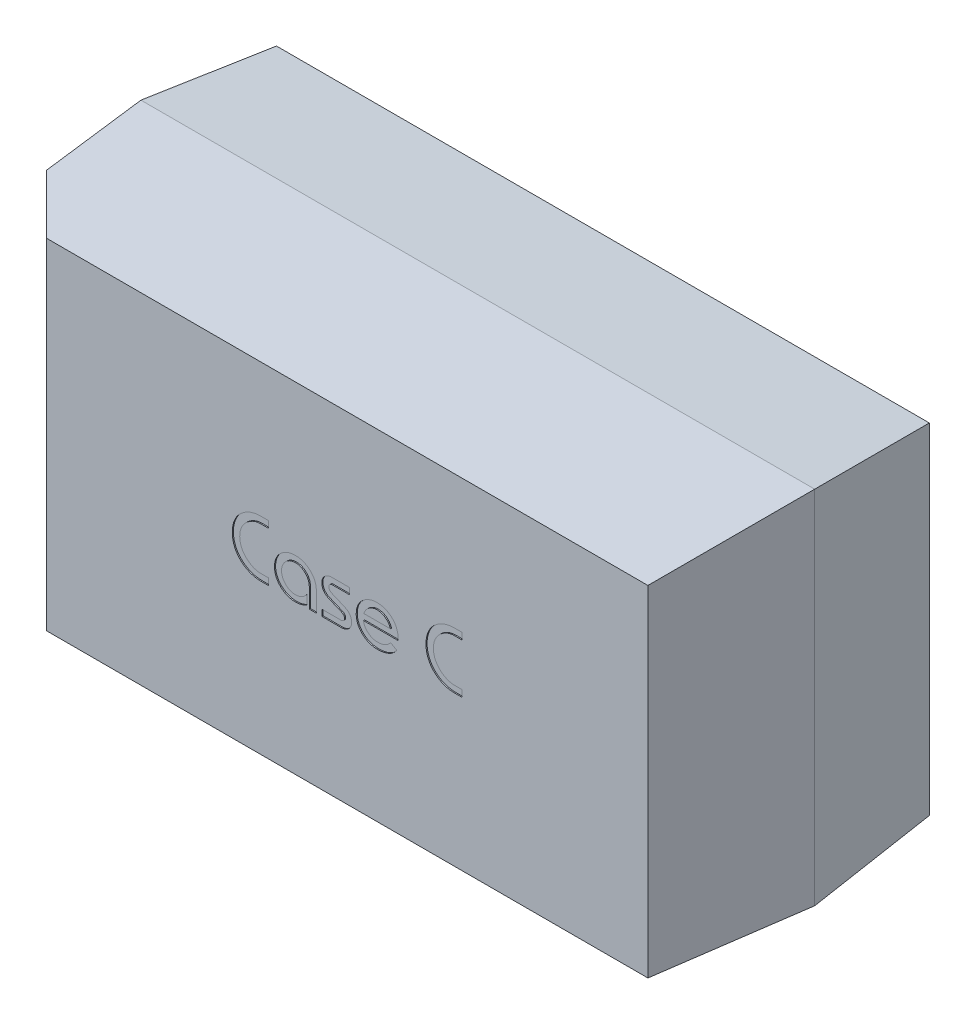
from build123d import *
from OCP.BRepFilletAPI import BRepFilletAPI_MakeChamfer

# Parameters (mm, degrees)
SKETCH1_W           = 6
SKETCH1_H           = 3.22
BOSS_EXTRUDE1_DEPTH = 2.5
CHAMFER3_SIZE       = 1.5
CHAMFER3_SIZE2      = 0.1
CHAMFER4_SIZE       = 0.1
CHAMFER4_SIZE_2     = 1.2
SKETCH2_W           = 3
SKETCH2_H           = 2.82
BOSS_EXTRUDE2_DEPTH = 0.1
CHAMFER5_SIZE       = 0.1
CHAMFER5_SIZE_2     = 0.057735027
CUT_EXTRUDE2_DEPTH  = 0.01
CUT_EXTRUDE4_DEPTH  = 10


# Some blends are built 0.0001 mm under size
with BuildPart() as part:
    # Sketch1 → Boss-Extrude1 (new body)
    with BuildSketch(Plane.XY):
        with Locations((3, 1.61)):
            Rectangle(SKETCH1_W, SKETCH1_H)
    extrude(amount=BOSS_EXTRUDE1_DEPTH)

    # Chamfer3: one chamfer whose edges measure the first distance from different faces: ONE call of the kernel's chamfer builder (chamfer() names one face for all edges)
    chamfer3_edges_1 = [part.edges().sort_by_distance(p)[0] for p in [
        (6, 1.61, 2.5),
    ]]
    chamfer3_side_1 = [part.faces().sort_by_distance(p)[0] for p in [
        (6, 1.61, 1.25),
    ]]
    chamfer3_edges_2 = [part.edges().sort_by_distance(p)[0] for p in [
        (3, 3.22, 2.5),
    ]]
    chamfer3_side_2 = [part.faces().sort_by_distance(p)[0] for p in [
        (3, 3.22, 1.25),
    ]]
    chamfer3_edges_3 = [part.edges().sort_by_distance(p)[0] for p in [
        (0, 1.61, 2.5),
    ]]
    chamfer3_side_3 = [part.faces().sort_by_distance(p)[0] for p in [
        (0, 1.61, 1.25),
    ]]
    chamfer3_edges_4 = [part.edges().sort_by_distance(p)[0] for p in [
        (3, 0, 2.5),
    ]]
    chamfer3_side_4 = [part.faces().sort_by_distance(p)[0] for p in [
        (3, 0, 1.25),
    ]]
    chamfer3 = BRepFilletAPI_MakeChamfer(part.part.solid().wrapped)
    for e in chamfer3_edges_1:
        chamfer3.Add(CHAMFER3_SIZE, CHAMFER3_SIZE2, e.wrapped, chamfer3_side_1[0].wrapped)  # the first distance lies on this face
    for e in chamfer3_edges_2:
        chamfer3.Add(CHAMFER3_SIZE, CHAMFER3_SIZE2, e.wrapped, chamfer3_side_2[0].wrapped)  # the first distance lies on this face
    for e in chamfer3_edges_3:
        chamfer3.Add(CHAMFER3_SIZE, CHAMFER3_SIZE2, e.wrapped, chamfer3_side_3[0].wrapped)  # the first distance lies on this face
    for e in chamfer3_edges_4:
        chamfer3.Add(CHAMFER3_SIZE, CHAMFER3_SIZE2, e.wrapped, chamfer3_side_4[0].wrapped)  # the first distance lies on this face
    add(Compound.cast(chamfer3.Shape()), mode=Mode.REPLACE)

    # Chamfer4
    # the kernel refuses this chamfer: 1.2, 0.1 mm, written as the material it takes off along each edge
    with BuildSketch(Plane(origin=(9.119601408, 3.22, 0), x_dir=(0, -0.9084886210333745, -0.4179095900465526), z_dir=(-1, 0, 0))) as chamfer4_piece_1:
        Polygon((CHAMFER4_SIZE * 0.908488621033, CHAMFER4_SIZE * 0.417909590047), (-CHAMFER4_SIZE_2 * 0.417909590047, CHAMFER4_SIZE_2 * 0.908488621033), (0, 0), align=None)
    extrude(amount=12.239202816, mode=Mode.SUBTRACT)
    with BuildSketch(Plane(origin=(0, 6.339601408, 0), x_dir=(-0.0031944650224573616, 0, 0.9999948976835934), z_dir=(0, -1, 0))) as chamfer4_piece_2:
        Polygon((CHAMFER4_SIZE_2 * 0.999994897684, -CHAMFER4_SIZE_2 * 0.00319446502246), (-CHAMFER4_SIZE * 0.00319446502246, -CHAMFER4_SIZE * 0.999994897684), (0, 0), align=None)
    extrude(amount=9.459202816, mode=Mode.SUBTRACT)
    with BuildSketch(Plane(origin=(-3.119601408, 0, 0), x_dir=(0, -0.0031944650224573663, 0.9999948976835934), z_dir=(1, 0, 0))) as chamfer4_piece_3:
        Polygon((CHAMFER4_SIZE_2 * 0.999994897684, -CHAMFER4_SIZE_2 * 0.00319446502246), (-CHAMFER4_SIZE * 0.00319446502246, -CHAMFER4_SIZE * 0.999994897684), (0, 0), align=None)
    extrude(amount=12.239202816, mode=Mode.SUBTRACT)
    with BuildSketch(Plane(origin=(6, -3.119601408, 0), x_dir=(-0.9084886210333732, 0, -0.41790959004655553), z_dir=(0, 1, 0))) as chamfer4_piece_4:
        Polygon((CHAMFER4_SIZE * 0.908488621033, CHAMFER4_SIZE * 0.417909590047), (-CHAMFER4_SIZE_2 * 0.417909590047, CHAMFER4_SIZE_2 * 0.908488621033), (0, 0), align=None)
    extrude(amount=9.459202816, mode=Mode.SUBTRACT)

    # Sketch2 → Boss-Extrude2 (add)
    with BuildSketch(Plane(origin=(0, 0, 0), x_dir=(-1, 0, 0), z_dir=(0, 0, -1))):
        with Locations((-3, 1.61)):
            Rectangle(SKETCH2_W, SKETCH2_H)
    extrude(amount=BOSS_EXTRUDE2_DEPTH)

    # Chamfer5
    chamfer5_edges_1 = [part.edges().sort_by_distance(p)[0] for p in [
        (4.5, 1.61, -0.1),
    ]]
    chamfer5_side_1 = [part.faces().sort_by_distance(p)[0] for p in [
        (4.5, 1.61, -0.098845299),
    ]]
    chamfer5_edges_2 = [part.edges().sort_by_distance(p)[0] for p in [
        (1.5, 1.61, -0.1),
    ]]
    chamfer5_side_2 = [part.faces().sort_by_distance(p)[0] for p in [
        (1.5, 1.61, -0.098845299),
    ]]
    chamfer5 = BRepFilletAPI_MakeChamfer(part.part.solid().wrapped)
    for e in chamfer5_edges_1:
        chamfer5.Add(CHAMFER5_SIZE - 0.0001, CHAMFER5_SIZE_2 - 0.0001, e.wrapped, chamfer5_side_1[0].wrapped)
    for e in chamfer5_edges_2:
        chamfer5.Add(CHAMFER5_SIZE - 0.0001, CHAMFER5_SIZE_2 - 0.0001, e.wrapped, chamfer5_side_2[0].wrapped)
    add(Compound.cast(chamfer5.Shape()), mode=Mode.REPLACE)  # a hair under: the kernel refuses the full size

    # Sketch5 → Cut-Extrude2 (cut)
    # profile 1 of 5: a face of its own
    with BuildSketch(Plane.XY.offset(2.5)):
        with BuildLine():
            Line((2.529784113, 1.433715838), (2.458954752, 1.433715838))
            add(Edge.make_bspline(
                [(2.458954752, 1.433715838), (2.451190353, 1.433915465), (2.435661817, 1.434314712), (2.412572822, 1.437611037), (2.389708123, 1.44272445), (2.367362746, 1.450072166), (2.345777626, 1.459250485), (2.325338048, 1.470309808), (2.306096157, 1.483008978), (2.294359969, 1.492862526), (2.288506706, 1.497776848)],
                knots=[0, 0, 0, 0, 1.001208266, 2.002382965, 3.002776937, 4.02036543, 5.032265952, 6.024514095, 7.01475349, 8, 8, 8, 8], degree=3))
            add(Edge.make_bspline(
                [(2.288506706, 1.497776848), (2.285293577, 1.500662797), (2.278886431, 1.506417527), (2.269958918, 1.515670333), (2.261623531, 1.525372657), (2.253832558, 1.535409356), (2.246643469, 1.545902391), (2.239962406, 1.556716952), (2.233934527, 1.568030385), (2.228560439, 1.579736064), (2.223596284, 1.591739177), (2.219640099, 1.604166088), (2.21586327, 1.616760339), (2.213133303, 1.629725782), (2.210727446, 1.642900515), (2.209340551, 1.656384857), (2.208146695, 1.67011053), (2.208081844, 1.679375501), (2.208049127, 1.684049489)],
                knots=[0, 0, 0, 0, 0.989761973, 1.973636693, 2.944619594, 3.920779654, 4.884522862, 5.858942109, 6.833279679, 7.820733948, 8.810844291, 9.808215719, 10.808747302, 11.823181674, 12.843456966, 13.877087317, 14.929034146, 16, 16, 16, 16], degree=3))
            add(Edge.make_bspline(
                [(2.208049127, 1.684049489), (2.208085561, 1.6886912), (2.208157777, 1.697891713), (2.209300205, 1.711564812), (2.210893816, 1.724955471), (2.213046514, 1.738118175), (2.216057646, 1.750948017), (2.21954722, 1.763567868), (2.223761216, 1.775880538), (2.22861429, 1.787918588), (2.234177141, 1.799583643), (2.240119345, 1.810985492), (2.246850349, 1.821859433), (2.254110065, 1.832329929), (2.261824395, 1.842514232), (2.27025244, 1.852202176), (2.27916484, 1.861589787), (2.285577386, 1.867405886), (2.288792693, 1.87032213)],
                knots=[0, 0, 0, 0, 1.063584854, 2.108172223, 3.142553315, 4.154327922, 5.163162232, 6.16161076, 7.154304801, 8.1443234, 9.134770556, 10.115448767, 11.089777724, 12.063562089, 13.035192332, 14.016357246, 15.005384098, 16, 16, 16, 16], degree=3))
            add(Edge.make_bspline(
                [(2.288792693, 1.87032213), (2.29466852, 1.875220196), (2.306426316, 1.885021449), (2.325880333, 1.89738303), (2.346325602, 1.908360532), (2.367910155, 1.917452404), (2.390243052, 1.924664553), (2.412934442, 1.929952197), (2.435892586, 1.933085503), (2.451255528, 1.933505403), (2.458954752, 1.933715838)],
                knots=[0, 0, 0, 0, 0.9893158, 1.9796658, 2.977055556, 3.990876023, 5.006830535, 6.011631783, 7.00351827, 8, 8, 8, 8], degree=3))
            Line((2.458954752, 1.933715838), (2.528830824, 1.933715838))
            Line((2.528830824, 1.933715838), (2.529784113, 1.8745166))
            Line((2.529784113, 1.8745166), (2.458954752, 1.8745166))
            add(Edge.make_bspline(
                [(2.458954752, 1.8745166), (2.453735363, 1.874335104), (2.443145163, 1.873966846), (2.427179909, 1.871442371), (2.41107759, 1.867023486), (2.394909158, 1.861203091), (2.379087308, 1.853766531), (2.363898006, 1.845088791), (2.349446053, 1.835139633), (2.340555703, 1.827537201), (2.336075819, 1.823706305)],
                knots=[0, 0, 0, 0, 0.922399681, 1.871559692, 2.848297118, 3.869795982, 4.904912568, 5.933748764, 6.958807485, 8, 8, 8, 8], degree=3))
            add(Edge.make_bspline(
                [(2.336075819, 1.823706305), (2.331105192, 1.818979442), (2.321336195, 1.809689529), (2.308742444, 1.794168664), (2.297944434, 1.777932532), (2.289264442, 1.760753876), (2.282400243, 1.742777598), (2.277601653, 1.723937371), (2.274510935, 1.70426578), (2.274183244, 1.690861416), (2.274016716, 1.684049489)],
                knots=[0, 0, 0, 0, 1.043561491, 2.05095784, 3.036015611, 4.007647816, 4.975513617, 5.960167242, 6.963383094, 8, 8, 8, 8], degree=3))
            add(Edge.make_bspline(
                [(2.274016716, 1.684049489), (2.274183545, 1.677237673), (2.274511828, 1.663833526), (2.277598239, 1.644160353), (2.282420076, 1.625297121), (2.289241336, 1.60727309), (2.297943772, 1.590069467), (2.308768889, 1.573824644), (2.32132967, 1.558218298), (2.33110371, 1.548864842), (2.336075819, 1.544106686)],
                knots=[0, 0, 0, 0, 1.035104675, 2.036857023, 3.020074222, 3.991046645, 4.961261421, 5.944882176, 6.954549968, 8, 8, 8, 8], degree=3))
            add(Edge.make_bspline(
                [(2.336075819, 1.544106686), (2.340550587, 1.54020653), (2.349414296, 1.532481023), (2.36390127, 1.522450463), (2.379059726, 1.51364666), (2.394915419, 1.506246703), (2.411058372, 1.500365078), (2.427206728, 1.496148117), (2.44313335, 1.49342721), (2.453733108, 1.493084098), (2.458954752, 1.492915075)],
                knots=[0, 0, 0, 0, 1.04672343, 2.073370516, 3.10338066, 4.136864607, 5.156752309, 6.130513482, 7.079055176, 8, 8, 8, 8], degree=3))
            Line((2.458954752, 1.492915075), (2.528830824, 1.492915075))
            Line((2.528830824, 1.492915075), (2.529784113, 1.433715838))
        make_face()
    # profile 2 of 5: a face of its own
    with BuildSketch(Plane.XY.offset(2.5)):
        with BuildLine():
            add(Edge.make_bspline(
                [(2.768773627, 1.729521367), (2.764603807, 1.729419163), (2.756386844, 1.729217763), (2.744305804, 1.727388142), (2.732630394, 1.724740922), (2.721511362, 1.72059814), (2.710736846, 1.715609505), (2.700548212, 1.709191665), (2.69066634, 1.701899867), (2.681531066, 1.693406445), (2.673079655, 1.684276449), (2.665701265, 1.674506643), (2.659447032, 1.664264632), (2.654428972, 1.653528209), (2.650295901, 1.642403039), (2.647646038, 1.6307293), (2.64581713, 1.618647808), (2.645615632, 1.610430908), (2.645513379, 1.606261119)],
                knots=[0, 0, 0, 0, 1.032177917, 2.033988752, 3.021003279, 3.992039754, 4.967309703, 5.956831733, 6.969039607, 8.00520122, 9.041362833, 10.047277634, 11.032690297, 12.007960246, 12.978996721, 13.966011248, 14.967822083, 16, 16, 16, 16], degree=3))
            add(Edge.make_bspline(
                [(2.645513379, 1.606261119), (2.645616789, 1.602091658), (2.645820565, 1.593875403), (2.647628257, 1.58181983), (2.650335831, 1.570163808), (2.654381146, 1.559038117), (2.659473754, 1.548332315), (2.6657269, 1.538099761), (2.673047274, 1.528253046), (2.681534021, 1.519117029), (2.690669759, 1.51062889), (2.700518911, 1.503314184), (2.710766831, 1.497025445), (2.721507408, 1.492012962), (2.73263147, 1.487878404), (2.74430551, 1.485228945), (2.756386921, 1.483399929), (2.764603832, 1.483198446), (2.768773627, 1.4830962)],
                knots=[0, 0, 0, 0, 1.032511964, 2.03464702, 3.01432259, 3.993080195, 4.961554741, 5.947286317, 6.959821775, 7.996318725, 9.032815675, 10.045351133, 11.031082708, 12.006668287, 12.978019023, 13.96535298, 14.967488036, 16, 16, 16, 16], degree=3))
            add(Edge.make_bspline(
                [(2.768773627, 1.4830962), (2.77390256, 1.483281816), (2.784076562, 1.483650012), (2.799059849, 1.486532908), (2.813589113, 1.491099201), (2.827448584, 1.497620575), (2.840543926, 1.505696049), (2.85245768, 1.515364096), (2.863256468, 1.526425777), (2.869259036, 1.534807086), (2.872300796, 1.539054255)],
                knots=[0, 0, 0, 0, 1.003913901, 1.991412451, 2.977497989, 3.979848145, 4.983241069, 5.983386257, 6.978094989, 8, 8, 8, 8], degree=3))
            Line((2.872300796, 1.539054255), (2.872300796, 1.456022797))
            add(Edge.make_bspline(
                [(2.872300796, 1.456022797), (2.868326319, 1.453712614), (2.860418623, 1.449116228), (2.848091962, 1.443212296), (2.835506436, 1.438247807), (2.822658777, 1.434235129), (2.809569075, 1.43108682), (2.796199799, 1.428778238), (2.782560275, 1.427437138), (2.773384032, 1.427238132), (2.768773627, 1.427138145)],
                knots=[0, 0, 0, 0, 1.013340786, 2.016162684, 3.010207893, 3.994126741, 4.981482304, 5.976712076, 6.983442674, 8, 8, 8, 8], degree=3))
            add(Edge.make_bspline(
                [(2.768773627, 1.427138145), (2.762568702, 1.427305833), (2.750268099, 1.427638256), (2.732049788, 1.430217413), (2.714298712, 1.434281374), (2.697088924, 1.440019706), (2.680637496, 1.447319566), (2.665106905, 1.456199055), (2.650409043, 1.466317372), (2.641556649, 1.474258478), (2.637124437, 1.478234427)],
                knots=[0, 0, 0, 0, 1.029305989, 2.040489696, 3.047112572, 4.047571049, 5.04605445, 6.028396224, 7.012858436, 8, 8, 8, 8], degree=3))
            add(Edge.make_bspline(
                [(2.637124437, 1.478234427), (2.632765227, 1.482559678), (2.624192071, 1.491066048), (2.613203161, 1.505279026), (2.603783787, 1.520159825), (2.596154735, 1.535914316), (2.590050726, 1.55236234), (2.585943045, 1.569654792), (2.583244237, 1.587682395), (2.582941292, 1.599991093), (2.582786973, 1.606261119)],
                knots=[0, 0, 0, 0, 1.028335175, 2.022402705, 3.00363116, 3.975505791, 4.951123991, 5.938060159, 6.949652064, 8, 8, 8, 8], degree=3))
            add(Edge.make_bspline(
                [(2.582786973, 1.606261119), (2.582943556, 1.612530776), (2.583251731, 1.624870221), (2.585928686, 1.642933821), (2.590070755, 1.660279888), (2.596132147, 1.676774716), (2.603783053, 1.692554678), (2.613229376, 1.7074454), (2.624185754, 1.721742406), (2.632763792, 1.730312513), (2.637124437, 1.734669127)],
                knots=[0, 0, 0, 0, 1.047948555, 2.062489918, 3.047171561, 4.025552603, 4.995207116, 5.974194084, 6.970181577, 8, 8, 8, 8], degree=3))
            add(Edge.make_bspline(
                [(2.637124437, 1.734669127), (2.641555788, 1.738615912), (2.650408292, 1.746500401), (2.665138398, 1.756497166), (2.680610693, 1.765418172), (2.6971125, 1.772582733), (2.71431079, 1.77830479), (2.732027288, 1.782557721), (2.750278385, 1.784939236), (2.762570734, 1.785298256), (2.768773627, 1.785479422)],
                knots=[0, 0, 0, 0, 0.984707269, 1.967148561, 2.950482705, 3.947840172, 4.949309321, 5.958151076, 6.969654197, 8, 8, 8, 8], degree=3))
            add(Edge.make_bspline(
                [(2.768773627, 1.785479422), (2.774976514, 1.785298248), (2.787268852, 1.784939213), (2.805520028, 1.782557811), (2.823236232, 1.778304456), (2.840435609, 1.772583964), (2.856933403, 1.765413623), (2.872397799, 1.756526892), (2.887053097, 1.746468509), (2.895892783, 1.738611061), (2.900327488, 1.734669127)],
                knots=[0, 0, 0, 0, 1.030904303, 2.04295571, 3.05234431, 4.054356306, 5.052254392, 6.036121553, 7.014758969, 8, 8, 8, 8], degree=3))
            add(Edge.make_bspline(
                [(2.900327488, 1.734669127), (2.904687242, 1.730312101), (2.913263527, 1.721741183), (2.924232651, 1.707450071), (2.933639294, 1.692525689), (2.94146433, 1.676822488), (2.947345441, 1.660254559), (2.951533808, 1.642937914), (2.954197416, 1.624869145), (2.954507433, 1.612530413), (2.954664952, 1.606261119)],
                knots=[0, 0, 0, 0, 1.029749437, 2.025670211, 3.004591598, 3.976522513, 4.953032564, 5.937648245, 6.952121645, 8, 8, 8, 8], degree=3))
            Line((2.954664952, 1.606261119), (2.954664952, 1.43352518))
            Line((2.954664952, 1.43352518), (2.891938546, 1.43352518))
            Line((2.891938546, 1.43352518), (2.891938546, 1.606261119))
            add(Edge.make_bspline(
                [(2.891938546, 1.606261119), (2.891836335, 1.610430933), (2.891634919, 1.618647885), (2.889805407, 1.630729007), (2.887157784, 1.642404115), (2.883016484, 1.653524255), (2.878022283, 1.664294611), (2.871639219, 1.674477554), (2.864283378, 1.684279697), (2.855827063, 1.693410071), (2.846696412, 1.701865002), (2.836896684, 1.709226462), (2.826728993, 1.715573723), (2.815993525, 1.720648263), (2.804871773, 1.724700351), (2.793214688, 1.727406096), (2.781159403, 1.729214283), (2.772943108, 1.729417992), (2.768773627, 1.729521367)],
                knots=[0, 0, 0, 0, 1.03279397, 2.035202735, 3.022806359, 3.994422395, 4.970274432, 5.960387057, 6.966902236, 8.003682281, 9.040462325, 10.046977504, 11.037090129, 12.005829191, 12.98485412, 13.964797265, 14.96720603, 16, 16, 16, 16], degree=3))
        make_face()
    # profile 3 of 5: a face of its own
    with BuildSketch(Plane.XY.offset(2.5)):
        with BuildLine():
            Line((3.176495267, 1.555450824), (3.064579156, 1.60273395))
            add(Edge.make_bspline(
                [(3.064579156, 1.60273395), (3.059713235, 1.604956968), (3.050296801, 1.609258909), (3.037649109, 1.617653061), (3.026937059, 1.627354625), (3.018138527, 1.638310273), (3.011371884, 1.650581514), (3.006468073, 1.664071695), (3.003606947, 1.678877179), (3.003266964, 1.689152932), (3.003092025, 1.694440337)],
                knots=[0, 0, 0, 0, 1.086913206, 2.103373124, 3.073395331, 4.016225338, 4.947889024, 5.91097369, 6.92508807, 8, 8, 8, 8], degree=3))
            add(Edge.make_bspline(
                [(3.003092025, 1.694440337), (3.003152698, 1.697305449), (3.003271947, 1.702936705), (3.004591011, 1.71120063), (3.006562361, 1.71916969), (3.009424545, 1.726823868), (3.013202768, 1.734106552), (3.017711677, 1.741088485), (3.022951256, 1.747814436), (3.029068337, 1.754020125), (3.035665017, 1.759843066), (3.042796366, 1.764888831), (3.050316247, 1.769063373), (3.05806637, 1.772715344), (3.066303533, 1.775278393), (3.074818836, 1.777364944), (3.083741779, 1.778491794), (3.089806739, 1.778637138), (3.092891835, 1.778711071)],
                knots=[0, 0, 0, 0, 1.002829457, 1.971019315, 2.92405256, 3.875133533, 4.826019057, 5.792479604, 6.783438632, 7.806815997, 8.840374075, 9.86266113, 10.859541967, 11.850813551, 12.857589228, 13.875503362, 14.919320925, 16, 16, 16, 16], degree=3))
            Line((3.092891835, 1.778711071), (3.250470481, 1.778711071))
            Line((3.250470481, 1.778711071), (3.250470481, 1.722753016))
            Line((3.250470481, 1.722753016), (3.09670499, 1.722753016))
            add(Edge.make_bspline(
                [(3.09670499, 1.722753016), (3.094629324, 1.722674414), (3.090576545, 1.722520943), (3.084745902, 1.720933485), (3.079397444, 1.718321358), (3.074721887, 1.714714003), (3.070718831, 1.710461275), (3.067971537, 1.705494634), (3.066114203, 1.700130226), (3.065918364, 1.696362777), (3.065818431, 1.694440337)],
                knots=[0, 0, 0, 0, 1.066372243, 2.082113002, 3.084329393, 4.111595171, 5.107383598, 6.067048916, 7.013660775, 8, 8, 8, 8], degree=3))
            add(Edge.make_bspline(
                [(3.065818431, 1.694440337), (3.065875859, 1.692051244), (3.065985473, 1.687491177), (3.067231462, 1.681060732), (3.069259666, 1.675402496), (3.072051381, 1.670342752), (3.076063859, 1.665952404), (3.081114621, 1.661988743), (3.087151163, 1.658116938), (3.09171785, 1.655998393), (3.09413111, 1.65487885)],
                knots=[0, 0, 0, 0, 1.09441688, 2.088916165, 2.987755487, 3.842645348, 4.719966779, 5.693972068, 6.781382117, 8, 8, 8, 8], degree=3))
            Line((3.09413111, 1.65487885), (3.202901368, 1.608834999))
            add(Edge.make_bspline(
                [(3.202901368, 1.608834999), (3.208053251, 1.606484631), (3.217997915, 1.601947723), (3.231357072, 1.593267987), (3.242785079, 1.583540006), (3.252036106, 1.572523938), (3.259353829, 1.560466443), (3.264394804, 1.547186648), (3.267527209, 1.532844336), (3.267910031, 1.522896657), (3.268106325, 1.517795914)],
                knots=[0, 0, 0, 0, 1.135523047, 2.191896784, 3.186910699, 4.13766825, 5.067609298, 6.00469982, 6.976895781, 8, 8, 8, 8], degree=3))
            add(Edge.make_bspline(
                [(3.268106325, 1.517795914), (3.268055448, 1.514897454), (3.267955354, 1.509194996), (3.266492678, 1.500846992), (3.264496988, 1.492775526), (3.261327396, 1.485132859), (3.257576501, 1.477701781), (3.252694583, 1.470771918), (3.247188545, 1.464004868), (3.240712882, 1.457834202), (3.233713406, 1.452089269), (3.226168994, 1.447173473), (3.218286606, 1.442900409), (3.209943707, 1.43946738), (3.201161018, 1.436806279), (3.191972333, 1.434910073), (3.182404424, 1.433734885), (3.175894924, 1.433595842), (3.172586782, 1.43352518)],
                knots=[0, 0, 0, 0, 0.978646858, 1.92539877, 2.858333228, 3.784063451, 4.716317137, 5.666962661, 6.643661373, 7.661792299, 8.685350883, 9.701495763, 10.701321719, 11.712912426, 12.746124259, 13.799692543, 14.881799231, 16, 16, 16, 16], degree=3))
            Line((3.172586782, 1.43352518), (3.003759328, 1.43352518))
            Line((3.003759328, 1.43352518), (3.003759328, 1.489483235))
            Line((3.003759328, 1.489483235), (3.16848764, 1.489483235))
            add(Edge.make_bspline(
                [(3.16848764, 1.489483235), (3.170977813, 1.489548677), (3.175824972, 1.489676061), (3.182709665, 1.491412892), (3.18911399, 1.493866137), (3.1946965, 1.497455468), (3.199452011, 1.501722715), (3.202958951, 1.506612161), (3.205111538, 1.512068664), (3.205352976, 1.515870531), (3.205475247, 1.517795914)],
                knots=[0, 0, 0, 0, 1.154928907, 2.248086845, 3.282544077, 4.331984353, 5.315035, 6.23746919, 7.107399511, 8, 8, 8, 8], degree=3))
            add(Edge.make_bspline(
                [(3.205475247, 1.517795914), (3.20537799, 1.519867687), (3.205187362, 1.523928414), (3.203856981, 1.529817879), (3.201493945, 1.535231067), (3.198340536, 1.54027151), (3.194159697, 1.544765197), (3.189102828, 1.548810327), (3.183161, 1.552429865), (3.178775123, 1.554417576), (3.176495267, 1.555450824)],
                knots=[0, 0, 0, 0, 0.979821605, 1.920474361, 2.836181352, 3.761825304, 4.719258691, 5.723895598, 6.816840502, 8, 8, 8, 8], degree=3))
        make_face()
    # profile 4 of 5: a face of its own
    with BuildSketch(Plane.XY.offset(2.5)):
        with BuildLine():
            add(Edge.make_bspline(
                [(3.499183541, 1.4830962), (3.505199856, 1.483246712), (3.51703976, 1.483542913), (3.534328492, 1.48630255), (3.550786179, 1.490655799), (3.566212868, 1.496845721), (3.580432352, 1.504650274), (3.593240941, 1.513902647), (3.604361948, 1.524745792), (3.610384077, 1.533020675), (3.613387545, 1.537147678)],
                knots=[0, 0, 0, 0, 1.096631666, 2.158134203, 3.18443435, 4.196098216, 5.181796095, 6.135856248, 7.070279626, 8, 8, 8, 8], degree=3))
            Line((3.613387545, 1.537147678), (3.668773627, 1.505593817))
            add(Edge.make_bspline(
                [(3.668773627, 1.505593817), (3.666535586, 1.502378553), (3.662092993, 1.495996135), (3.654573266, 1.487123031), (3.646591984, 1.478831094), (3.638053015, 1.471152571), (3.628979405, 1.464121158), (3.619439905, 1.457583253), (3.60931777, 1.451789066), (3.59867094, 1.44662035), (3.587517307, 1.442063793), (3.575839022, 1.438047283), (3.563626424, 1.434600869), (3.550856203, 1.431855788), (3.53754762, 1.429775229), (3.52374149, 1.428275728), (3.509398677, 1.427267665), (3.499661956, 1.42718185), (3.494703084, 1.427138145)],
                knots=[0, 0, 0, 0, 0.942964575, 1.871819471, 2.797263628, 3.713038984, 4.634551539, 5.559964056, 6.495853453, 7.440462311, 8.408221378, 9.395599076, 10.413120145, 11.462291805, 12.53922733, 13.655571982, 14.805992184, 16, 16, 16, 16], degree=3))
            add(Edge.make_bspline(
                [(3.494703084, 1.427138145), (3.488498074, 1.427305644), (3.476197301, 1.427637693), (3.457980241, 1.430219614), (3.440224458, 1.434273177), (3.423044329, 1.440045983), (3.406539525, 1.44719646), (3.39106802, 1.456121177), (3.376337707, 1.466116971), (3.367485231, 1.47400159), (3.363053894, 1.47794844)],
                knots=[0, 0, 0, 0, 1.030410189, 2.042678656, 3.050381398, 4.051913128, 5.04933292, 6.032728512, 7.015231197, 8, 8, 8, 8], degree=3))
            add(Edge.make_bspline(
                [(3.363053894, 1.47794844), (3.358691827, 1.482304178), (3.350110993, 1.490872562), (3.339191306, 1.505160687), (3.329681598, 1.519980529), (3.322089533, 1.535727115), (3.315978738, 1.552170742), (3.311872876, 1.5694644), (3.309178393, 1.587460182), (3.308872077, 1.599736952), (3.30871643, 1.605975132)],
                knots=[0, 0, 0, 0, 1.032406655, 2.030897353, 3.007837836, 3.979929372, 4.95576531, 5.942921743, 6.954739417, 8, 8, 8, 8], degree=3))
            add(Edge.make_bspline(
                [(3.30871643, 1.605975132), (3.308869839, 1.612245405), (3.309170998, 1.624554588), (3.311887317, 1.642609279), (3.315958393, 1.659943964), (3.322111463, 1.676435929), (3.329680928, 1.692251896), (3.339163254, 1.707157408), (3.350114053, 1.721456944), (3.358692858, 1.730026703), (3.363053894, 1.73438314)],
                knots=[0, 0, 0, 0, 1.047989187, 2.057309378, 3.047192212, 4.020619482, 4.995090611, 5.974115537, 6.970141648, 8, 8, 8, 8], degree=3))
            add(Edge.make_bspline(
                [(3.363053894, 1.73438314), (3.367492604, 1.738349373), (3.376371607, 1.746283254), (3.390976593, 1.756545755), (3.40660112, 1.765268885), (3.423010798, 1.77261784), (3.440245369, 1.778294204), (3.457955372, 1.782560559), (3.476208193, 1.78493851), (3.488500309, 1.785298012), (3.494703084, 1.785479422)],
                knots=[0, 0, 0, 0, 0.987025885, 1.974403735, 2.954037546, 3.95240394, 4.952745179, 5.960450721, 6.97081463, 8, 8, 8, 8], degree=3))
            add(Edge.make_bspline(
                [(3.494703084, 1.785479422), (3.500905853, 1.785298005), (3.513197958, 1.784938487), (3.531450859, 1.782560649), (3.549160562, 1.77829387), (3.566396244, 1.77261908), (3.582801813, 1.765264304), (3.598418739, 1.756575177), (3.612948267, 1.746251335), (3.621814792, 1.73834449), (3.626256944, 1.73438314)],
                knots=[0, 0, 0, 0, 1.029739185, 2.040646782, 3.04889458, 4.049774113, 5.048677738, 6.0288387, 7.012442986, 8, 8, 8, 8], degree=3))
            add(Edge.make_bspline(
                [(3.626256944, 1.73438314), (3.63061709, 1.730026293), (3.639194145, 1.721455729), (3.650157669, 1.707162051), (3.659600297, 1.69222304), (3.667343957, 1.676483653), (3.67331643, 1.659918432), (3.677434082, 1.64261338), (3.680137059, 1.624553508), (3.68044006, 1.612245041), (3.680594409, 1.605975132)],
                knots=[0, 0, 0, 0, 1.029792029, 2.025753997, 3.004715874, 3.981454246, 4.953004026, 5.942823112, 6.952078303, 8, 8, 8, 8], degree=3))
            Line((3.680594409, 1.605975132), (3.680594409, 1.586337382))
            Line((3.680594409, 1.586337382), (3.37277744, 1.586337382))
            add(Edge.make_bspline(
                [(3.37277744, 1.586337382), (3.373444868, 1.582700932), (3.374764245, 1.575512358), (3.377833663, 1.565060053), (3.381895398, 1.555103688), (3.386711556, 1.545558617), (3.392527476, 1.536542682), (3.399065841, 1.527941176), (3.406615948, 1.519885628), (3.414899038, 1.512312363), (3.423937191, 1.505514321), (3.43338986, 1.499434656), (3.443332153, 1.494383077), (3.453686987, 1.490290526), (3.464416667, 1.486998287), (3.475621778, 1.484728662), (3.487266377, 1.48338719), (3.495176212, 1.48319405), (3.499183541, 1.4830962)],
                knots=[0, 0, 0, 0, 0.996282716, 1.969462242, 2.930309334, 3.891958069, 4.847290049, 5.818809116, 6.800809464, 7.819635613, 8.840800131, 9.846065981, 10.84602503, 11.841865674, 12.844573127, 13.867747955, 14.919745267, 16, 16, 16, 16], degree=3))
        make_face()
        with BuildLine():
            Line((3.376685924, 1.642295437), (3.612815572, 1.642295437))
            add(Edge.make_bspline(
                [(3.612815572, 1.642295437), (3.611774733, 1.64542328), (3.609708846, 1.651631513), (3.605931234, 1.660646243), (3.60125994, 1.669109407), (3.596209027, 1.677296793), (3.590141677, 1.684794995), (3.58372822, 1.692130718), (3.57643886, 1.698839628), (3.568646278, 1.705126284), (3.560413127, 1.710836066), (3.551796134, 1.715755955), (3.543031996, 1.720132882), (3.533885775, 1.723562958), (3.524473589, 1.72621823), (3.514814747, 1.728120978), (3.504901458, 1.729313422), (3.498201886, 1.729451315), (3.494798412, 1.729521367)],
                knots=[0, 0, 0, 0, 1.006096813, 1.996930292, 2.977696053, 3.954424932, 4.928453262, 5.917576276, 6.926334417, 7.94728217, 8.972322098, 9.980473887, 10.973820191, 11.959179279, 12.957061003, 13.955696628, 14.961466125, 16, 16, 16, 16], degree=3))
            add(Edge.make_bspline(
                [(3.494798412, 1.729521367), (3.491426885, 1.729449703), (3.484759437, 1.729307983), (3.474907118, 1.728130682), (3.465314321, 1.726215406), (3.455962653, 1.723561476), (3.446904859, 1.720084705), (3.438051557, 1.716017478), (3.429556651, 1.710982224), (3.42133534, 1.705317475), (3.413529454, 1.699071336), (3.406390266, 1.692251145), (3.399754739, 1.685114827), (3.393825459, 1.677455813), (3.388574734, 1.669299975), (3.383912106, 1.660735343), (3.379840967, 1.651732287), (3.377744489, 1.645461643), (3.376685924, 1.642295437)],
                knots=[0, 0, 0, 0, 1.029283803, 2.035485625, 3.02503381, 4.014010936, 4.999793576, 5.985194093, 6.985389247, 8.010869784, 9.032256387, 10.034379471, 11.02326139, 12.005359921, 12.987746022, 13.982087615, 14.981105376, 16, 16, 16, 16], degree=3))
        make_face(mode=Mode.SUBTRACT)
    # profile 5 of 5: a face of its own
    with BuildSketch(Plane.XY.offset(2.5)):
        with BuildLine():
            Line((4.250279823, 1.433715838), (4.179450462, 1.433715838))
            add(Edge.make_bspline(
                [(4.179450462, 1.433715838), (4.171686064, 1.433915465), (4.156157527, 1.434314712), (4.133068533, 1.437611037), (4.110203833, 1.44272445), (4.087858456, 1.450072166), (4.066273336, 1.459250485), (4.045833758, 1.470309808), (4.026591867, 1.483008978), (4.014855679, 1.492862526), (4.009002416, 1.497776848)],
                knots=[0, 0, 0, 0, 1.001208266, 2.002382965, 3.002776937, 4.02036543, 5.032265952, 6.024514095, 7.01475349, 8, 8, 8, 8], degree=3))
            add(Edge.make_bspline(
                [(4.009002416, 1.497776848), (4.005789287, 1.500662797), (3.999382142, 1.506417527), (3.990454628, 1.515670333), (3.982119241, 1.525372657), (3.974328268, 1.535409356), (3.967139179, 1.545902391), (3.960458116, 1.556716952), (3.954430237, 1.568030385), (3.949056149, 1.579736064), (3.944091994, 1.591739177), (3.940135809, 1.604166088), (3.93635898, 1.616760339), (3.933629013, 1.629725782), (3.931223156, 1.642900515), (3.929836261, 1.656384857), (3.928642405, 1.67011053), (3.928577554, 1.679375501), (3.928544838, 1.684049489)],
                knots=[0, 0, 0, 0, 0.989761973, 1.973636693, 2.944619594, 3.920779654, 4.884522862, 5.858942109, 6.833279679, 7.820733948, 8.810844291, 9.808215719, 10.808747302, 11.823181674, 12.843456966, 13.877087317, 14.929034146, 16, 16, 16, 16], degree=3))
            add(Edge.make_bspline(
                [(3.928544838, 1.684049489), (3.928581271, 1.6886912), (3.928653487, 1.697891713), (3.929795915, 1.711564812), (3.931389526, 1.724955471), (3.933542224, 1.738118175), (3.936553356, 1.750948017), (3.94004293, 1.763567868), (3.944256927, 1.775880538), (3.949110001, 1.787918588), (3.954672851, 1.799583643), (3.960615055, 1.810985492), (3.967346059, 1.821859433), (3.974605775, 1.832329929), (3.982320105, 1.842514232), (3.99074815, 1.852202176), (3.999660551, 1.861589787), (4.006073096, 1.867405886), (4.009288403, 1.87032213)],
                knots=[0, 0, 0, 0, 1.063584854, 2.108172223, 3.142553315, 4.154327922, 5.163162232, 6.16161076, 7.154304801, 8.1443234, 9.134770556, 10.115448767, 11.089777724, 12.063562089, 13.035192332, 14.016357246, 15.005384098, 16, 16, 16, 16], degree=3))
            add(Edge.make_bspline(
                [(4.009288403, 1.87032213), (4.01516423, 1.875220196), (4.026922027, 1.885021449), (4.046376043, 1.89738303), (4.066821313, 1.908360532), (4.088405865, 1.917452404), (4.110738762, 1.924664553), (4.133430152, 1.929952197), (4.156388297, 1.933085503), (4.171751239, 1.933505403), (4.179450462, 1.933715838)],
                knots=[0, 0, 0, 0, 0.9893158, 1.9796658, 2.977055556, 3.990876023, 5.006830535, 6.011631783, 7.00351827, 8, 8, 8, 8], degree=3))
            Line((4.179450462, 1.933715838), (4.249326534, 1.933715838))
            Line((4.249326534, 1.933715838), (4.250279823, 1.8745166))
            Line((4.250279823, 1.8745166), (4.179450462, 1.8745166))
            add(Edge.make_bspline(
                [(4.179450462, 1.8745166), (4.174231073, 1.874335104), (4.163640873, 1.873966846), (4.147675619, 1.871442371), (4.1315733, 1.867023486), (4.115404868, 1.861203091), (4.099583018, 1.853766531), (4.084393717, 1.845088791), (4.069941763, 1.835139633), (4.061051413, 1.827537201), (4.05657153, 1.823706305)],
                knots=[0, 0, 0, 0, 0.922399681, 1.871559692, 2.848297118, 3.869795982, 4.904912568, 5.933748764, 6.958807485, 8, 8, 8, 8], degree=3))
            add(Edge.make_bspline(
                [(4.05657153, 1.823706305), (4.051600902, 1.818979442), (4.041831905, 1.809689529), (4.029238154, 1.794168664), (4.018440144, 1.777932532), (4.009760152, 1.760753876), (4.002895953, 1.742777598), (3.998097363, 1.723937371), (3.995006645, 1.70426578), (3.994678954, 1.690861416), (3.994512426, 1.684049489)],
                knots=[0, 0, 0, 0, 1.043561491, 2.05095784, 3.036015611, 4.007647816, 4.975513617, 5.960167242, 6.963383094, 8, 8, 8, 8], degree=3))
            add(Edge.make_bspline(
                [(3.994512426, 1.684049489), (3.994679255, 1.677237673), (3.995007538, 1.663833526), (3.998093949, 1.644160353), (4.002915786, 1.625297121), (4.009737047, 1.60727309), (4.018439482, 1.590069467), (4.029264599, 1.573824644), (4.04182538, 1.558218298), (4.05159942, 1.548864842), (4.05657153, 1.544106686)],
                knots=[0, 0, 0, 0, 1.035104675, 2.036857023, 3.020074222, 3.991046645, 4.961261421, 5.944882176, 6.954549968, 8, 8, 8, 8], degree=3))
            add(Edge.make_bspline(
                [(4.05657153, 1.544106686), (4.061046297, 1.54020653), (4.069910006, 1.532481023), (4.08439698, 1.522450463), (4.099555436, 1.51364666), (4.115411129, 1.506246703), (4.131554082, 1.500365078), (4.147702438, 1.496148117), (4.163629061, 1.49342721), (4.174228818, 1.493084098), (4.179450462, 1.492915075)],
                knots=[0, 0, 0, 0, 1.04672343, 2.073370516, 3.10338066, 4.136864607, 5.156752309, 6.130513482, 7.079055176, 8, 8, 8, 8], degree=3))
            Line((4.179450462, 1.492915075), (4.249326534, 1.492915075))
            Line((4.249326534, 1.492915075), (4.250279823, 1.433715838))
        make_face()
    extrude(amount=-CUT_EXTRUDE2_DEPTH, mode=Mode.SUBTRACT)

    # Sketch7 → Cut-Extrude4 (cut)
    with BuildSketch(Plane(origin=(0, 0, 0), x_dir=(1, 0, 0), z_dir=(0, 1, 0))):
        Polygon((0.565769278, -2.506820906), (0.065769278, -2.006820906), (0.065769278, -2.506820906), align=None)
    extrude(amount=CUT_EXTRUDE4_DEPTH, mode=Mode.SUBTRACT)


solid = part.part
